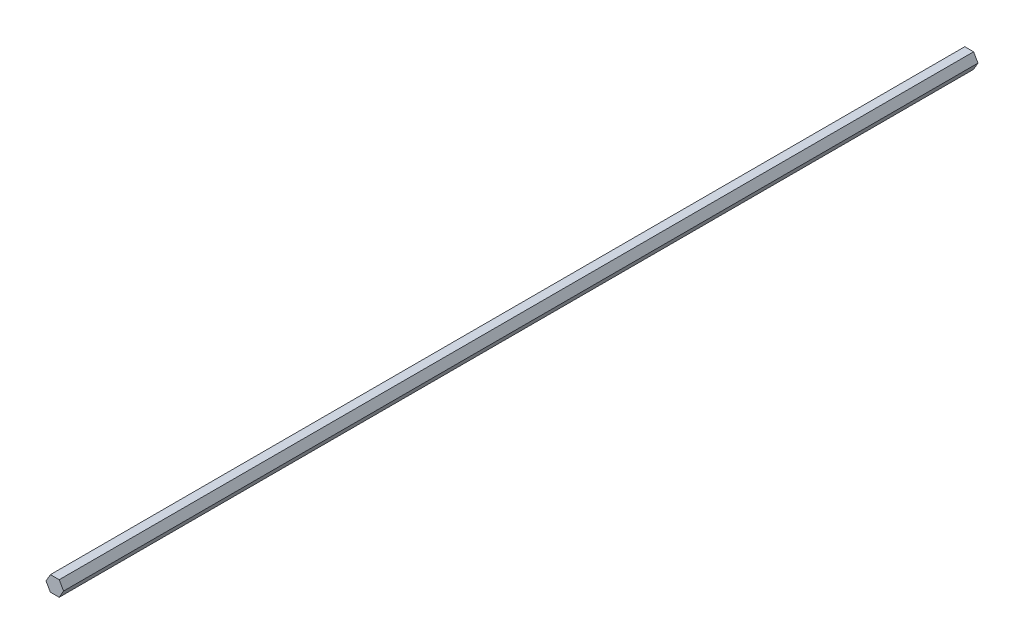
from build123d import *

# Parameters (mm, degrees)
BOSS_EXTRUDE1_DEPTH = 762


with BuildPart() as part:
    # Sketch1 → Boss-Extrude1 (new body)
    with BuildSketch(Plane.XY):
        Polygon((3.676109497, -6.344253486), (7.332339436, 0.011477468), (3.656229939, 6.355730955), (-3.676109497, 6.344253486), (-7.332339436, -0.011477468), (-3.656229939, -6.355730955), align=None)
    extrude(amount=BOSS_EXTRUDE1_DEPTH)


solid = part.part
